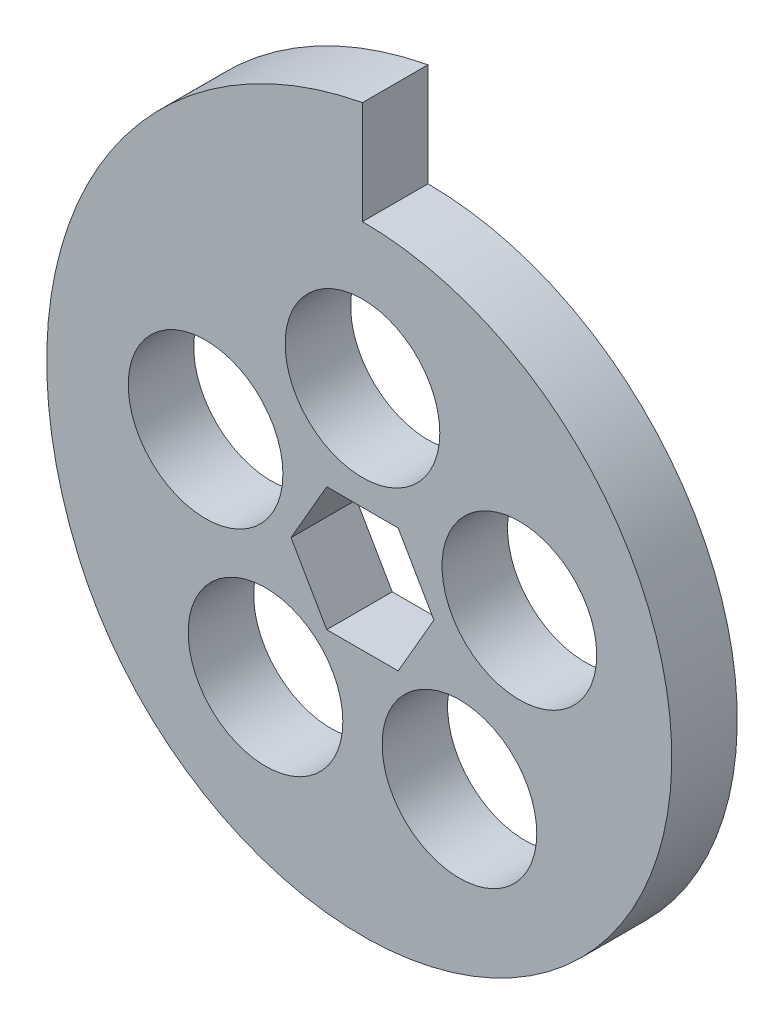
from build123d import *

# Parameters (mm, degrees)
SKETCH3_R           = 7.5
BOSS_EXTRUDE1_DEPTH = 6.35


with BuildPart() as part:
    # Sketch3 → Boss-Extrude1 (new body)
    with BuildSketch(Plane.XY):
        with BuildLine():
            Line((0, 30), (0, 40))
            ThreePointArc((0, 40), (-26.226618707, 20.675980746), (-27.550099413, -11.874006163))
            ThreePointArc((-27.550099413, -11.874006163), (25.062124659, -16.489084497), (0, 30))
        make_face()
        with Locations((0, 16)):
            Circle(SKETCH3_R, mode=Mode.SUBTRACT)
        with Locations((15.216904261, 4.94427191)):
            Circle(SKETCH3_R, mode=Mode.SUBTRACT)
        with Locations((9.404564037, -12.94427191)):
            Circle(SKETCH3_R, mode=Mode.SUBTRACT)
        with Locations((-9.404564037, -12.94427191)):
            Circle(SKETCH3_R, mode=Mode.SUBTRACT)
        with Locations((-15.216904261, 4.94427191)):
            Circle(SKETCH3_R, mode=Mode.SUBTRACT)
        Polygon((6.92820323, 0), (3.464101615, 6), (-3.464101615, 6), (-6.92820323, 0), (-3.464101615, -6), (3.464101615, -6), align=None, mode=Mode.SUBTRACT)
    extrude(amount=BOSS_EXTRUDE1_DEPTH)


solid = part.part
